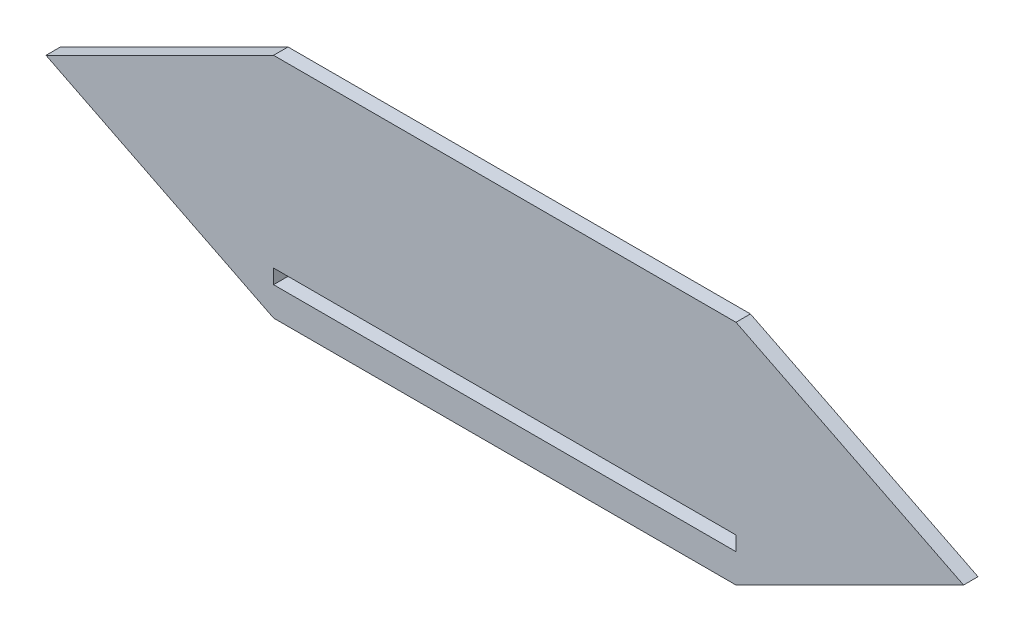
from build123d import *

# Parameters (mm, degrees)
BOSS_EXTRUDE1_DEPTH = 6.35
BOSS_EXTRUDE3_DEPTH = 25
SKETCH3_W           = 203.2
SKETCH3_H           = 6.35
CUT_EXTRUDE1_DEPTH  = 10


with BuildPart() as part:
    # Sketch1 → Boss-Extrude1 (new body)
    with BuildSketch(Plane.XY):
        Polygon((203.2, 100), (0, 100), (-100, 50), (0, 0), (203.2, 0), (303.2, 50), align=None)
    extrude(amount=BOSS_EXTRUDE1_DEPTH)

    # Sketch2 → Boss-Extrude3 (add)
    with BuildSketch(Plane(origin=(0, 0, 0), x_dir=(-1, 0, 0), z_dir=(0, 0, -1))):
        Polygon((-177.8, 12.7), (-203.2, 12.7), (-203.2, 19.05), (-177.8, 19.05), (-177.8, 25.05), (-209.2, 25.05), (-209.2, 6.7), (-177.8, 6.7), align=None)
        Polygon((6, 6.7), (6, 25.05), (-25.4, 25.05), (-25.4, 19.05), (0, 19.05), (0, 12.7), (-25.4, 12.7), (-25.4, 6.7), align=None)
    extrude(amount=BOSS_EXTRUDE3_DEPTH)

    # Sketch3 → Cut-Extrude1 (cut)
    with BuildSketch(Plane(origin=(0, 0, 0), x_dir=(-1, 0, 0), z_dir=(0, 0, -1))):
        with Locations((-101.6, 15.875)):
            Rectangle(SKETCH3_W, SKETCH3_H)
    extrude(amount=-CUT_EXTRUDE1_DEPTH, mode=Mode.SUBTRACT)


solid = part.part
